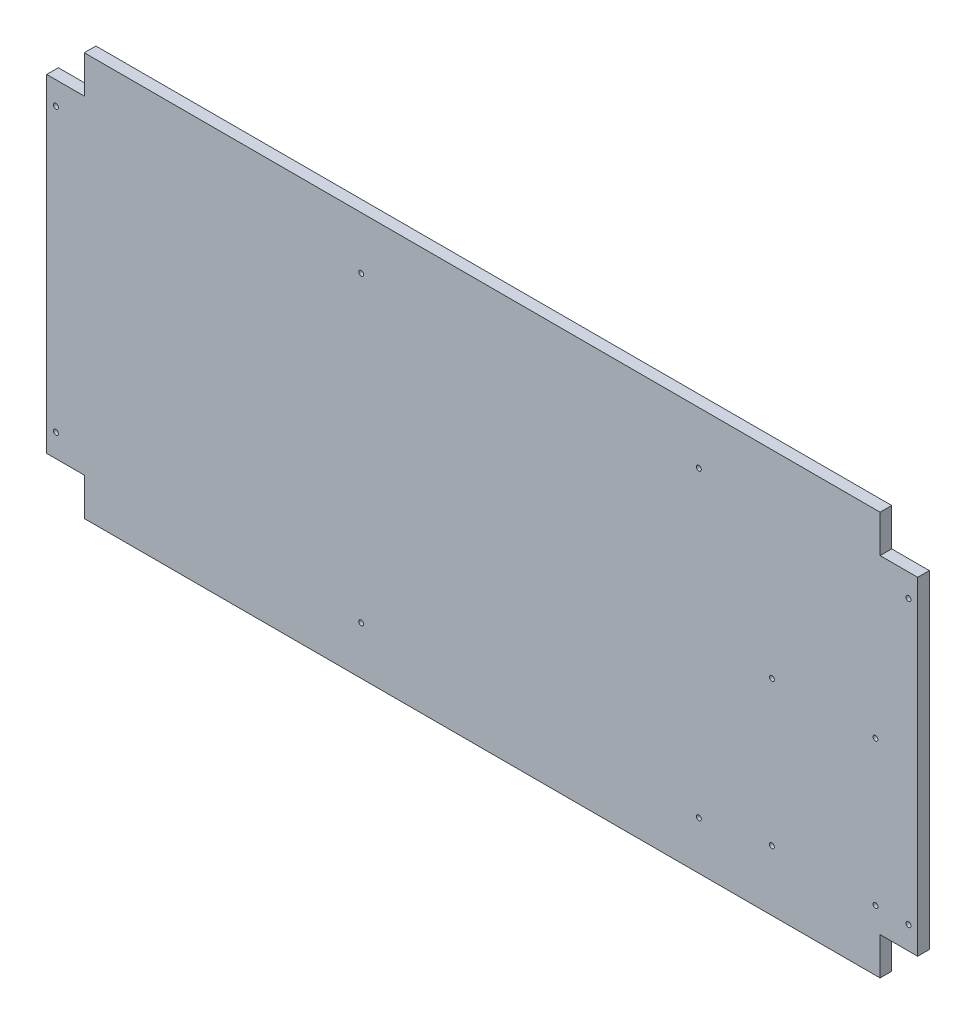
from build123d import *

# Parameters (mm, degrees)
SKETCH2_W           = 950
SKETCH2_H           = 440
BOSS_EXTRUDE1_DEPTH = 12.7
CUT_EXTRUDE1_REACH  = 525.628
SKETCH3_W           = 41
SKETCH3_H           = 41
CUT_EXTRUDE2_REACH  = 525.628
SKETCH4_R           = 2.75
CUT_EXTRUDE3_REACH  = 525.628
SKETCH6_R           = 2.665
CUT_EXTRUDE4_REACH  = 525.628
SKETCH7_R           = 2.665


with BuildPart() as part:
    # Sketch2 → Boss-Extrude1 (new body)
    with BuildSketch(Plane.XY):
        Rectangle(SKETCH2_W, SKETCH2_H)
    extrude(amount=BOSS_EXTRUDE1_DEPTH)

    # Sketch3 → Cut-Extrude1 (cut, up to next)
    with BuildSketch(Plane.XY.offset(12.7), mode=Mode.PRIVATE) as cut_extrude1_sk1:
        with Locations((-454.5, 199.5)):
            Rectangle(SKETCH3_W, SKETCH3_H)
    cut_extrude1_tool1 = extrude(cut_extrude1_sk1.sketch, amount=-CUT_EXTRUDE1_REACH, mode=Mode.PRIVATE) & part.part
    # Sketch3 → Cut-Extrude1 (cut, up to next)
    with BuildSketch(Plane.XY.offset(12.7), mode=Mode.PRIVATE) as cut_extrude1_sk2:
        with Locations((454.5, 199.5)):
            Rectangle(SKETCH3_W, SKETCH3_H)
    cut_extrude1_tool2 = extrude(cut_extrude1_sk2.sketch, amount=-CUT_EXTRUDE1_REACH, mode=Mode.PRIVATE) & part.part
    # Sketch3 → Cut-Extrude1 (cut, up to next)
    with BuildSketch(Plane.XY.offset(12.7), mode=Mode.PRIVATE) as cut_extrude1_sk3:
        with Locations((454.5, -199.5)):
            Rectangle(SKETCH3_W, SKETCH3_H)
    cut_extrude1_tool3 = extrude(cut_extrude1_sk3.sketch, amount=-CUT_EXTRUDE1_REACH, mode=Mode.PRIVATE) & part.part
    # Sketch3 → Cut-Extrude1 (cut, up to next)
    with BuildSketch(Plane.XY.offset(12.7), mode=Mode.PRIVATE) as cut_extrude1_sk4:
        with Locations((-454.5, -199.5)):
            Rectangle(SKETCH3_W, SKETCH3_H)
    cut_extrude1_tool4 = extrude(cut_extrude1_sk4.sketch, amount=-CUT_EXTRUDE1_REACH, mode=Mode.PRIVATE) & part.part
    add(cut_extrude1_tool1.solids().sort_by_distance((-454.5, 199.5, 12.7))[0], mode=Mode.SUBTRACT)
    add(cut_extrude1_tool2.solids().sort_by_distance((454.5, 199.5, 12.7))[0], mode=Mode.SUBTRACT)
    add(cut_extrude1_tool3.solids().sort_by_distance((454.5, -199.5, 12.7))[0], mode=Mode.SUBTRACT)
    add(cut_extrude1_tool4.solids().sort_by_distance((-454.5, -199.5, 12.7))[0], mode=Mode.SUBTRACT)

    # Sketch4 → Cut-Extrude2 (cut, up to next)
    with BuildSketch(Plane.XY.offset(12.7), mode=Mode.PRIVATE) as cut_extrude2_sk1:
        with Locations((-465, -154)):
            Circle(SKETCH4_R)
    cut_extrude2_tool1 = extrude(cut_extrude2_sk1.sketch, amount=-CUT_EXTRUDE2_REACH, mode=Mode.PRIVATE) & part.part
    # Sketch4 → Cut-Extrude2 (cut, up to next)
    with BuildSketch(Plane.XY.offset(12.7), mode=Mode.PRIVATE) as cut_extrude2_sk2:
        with Locations((-465, 154)):
            Circle(SKETCH4_R)
    cut_extrude2_tool2 = extrude(cut_extrude2_sk2.sketch, amount=-CUT_EXTRUDE2_REACH, mode=Mode.PRIVATE) & part.part
    # Sketch4 → Cut-Extrude2 (cut, up to next)
    with BuildSketch(Plane.XY.offset(12.7), mode=Mode.PRIVATE) as cut_extrude2_sk3:
        with Locations((465, -154)):
            Circle(SKETCH4_R)
    cut_extrude2_tool3 = extrude(cut_extrude2_sk3.sketch, amount=-CUT_EXTRUDE2_REACH, mode=Mode.PRIVATE) & part.part
    # Sketch4 → Cut-Extrude2 (cut, up to next)
    with BuildSketch(Plane.XY.offset(12.7), mode=Mode.PRIVATE) as cut_extrude2_sk4:
        with Locations((465, 154)):
            Circle(SKETCH4_R)
    cut_extrude2_tool4 = extrude(cut_extrude2_sk4.sketch, amount=-CUT_EXTRUDE2_REACH, mode=Mode.PRIVATE) & part.part
    add(cut_extrude2_tool1.solids().sort_by_distance((-465, -154, 12.7))[0], mode=Mode.SUBTRACT)
    add(cut_extrude2_tool2.solids().sort_by_distance((-465, 154, 12.7))[0], mode=Mode.SUBTRACT)
    add(cut_extrude2_tool3.solids().sort_by_distance((465, -154, 12.7))[0], mode=Mode.SUBTRACT)
    add(cut_extrude2_tool4.solids().sort_by_distance((465, 154, 12.7))[0], mode=Mode.SUBTRACT)

    # Sketch6 → Cut-Extrude3 (cut, up to next)
    with BuildSketch(Plane.XY.offset(12.7), mode=Mode.PRIVATE) as cut_extrude3_sk1:
        with Locations((-131.973398032, -167.519449166)):
            Circle(SKETCH6_R)
    cut_extrude3_tool1 = extrude(cut_extrude3_sk1.sketch, amount=-CUT_EXTRUDE3_REACH, mode=Mode.PRIVATE) & part.part
    # Sketch6 → Cut-Extrude3 (cut, up to next)
    with BuildSketch(Plane.XY.offset(12.7), mode=Mode.PRIVATE) as cut_extrude3_sk2:
        with Locations((236.326601968, -167.519449166)):
            Circle(SKETCH6_R)
    cut_extrude3_tool2 = extrude(cut_extrude3_sk2.sketch, amount=-CUT_EXTRUDE3_REACH, mode=Mode.PRIVATE) & part.part
    # Sketch6 → Cut-Extrude3 (cut, up to next)
    with BuildSketch(Plane.XY.offset(12.7), mode=Mode.PRIVATE) as cut_extrude3_sk3:
        with Locations((236.326601968, 162.680550834)):
            Circle(SKETCH6_R)
    cut_extrude3_tool3 = extrude(cut_extrude3_sk3.sketch, amount=-CUT_EXTRUDE3_REACH, mode=Mode.PRIVATE) & part.part
    # Sketch6 → Cut-Extrude3 (cut, up to next)
    with BuildSketch(Plane.XY.offset(12.7), mode=Mode.PRIVATE) as cut_extrude3_sk4:
        with Locations((-131.973398032, 162.680550834)):
            Circle(SKETCH6_R)
    cut_extrude3_tool4 = extrude(cut_extrude3_sk4.sketch, amount=-CUT_EXTRUDE3_REACH, mode=Mode.PRIVATE) & part.part
    add(cut_extrude3_tool1.solids().sort_by_distance((-131.973398, -167.519449, 12.7))[0], mode=Mode.SUBTRACT)
    add(cut_extrude3_tool2.solids().sort_by_distance((236.326602, -167.519449, 12.7))[0], mode=Mode.SUBTRACT)
    add(cut_extrude3_tool3.solids().sort_by_distance((236.326602, 162.680551, 12.7))[0], mode=Mode.SUBTRACT)
    add(cut_extrude3_tool4.solids().sort_by_distance((-131.973398, 162.680551, 12.7))[0], mode=Mode.SUBTRACT)

    # Sketch7 → Cut-Extrude4 (cut, up to next)
    with BuildSketch(Plane.XY.offset(12.7), mode=Mode.PRIVATE) as cut_extrude4_sk1:
        with Locations((429, 4)):
            Circle(SKETCH7_R)
    cut_extrude4_tool1 = extrude(cut_extrude4_sk1.sketch, amount=-CUT_EXTRUDE4_REACH, mode=Mode.PRIVATE) & part.part
    # Sketch7 → Cut-Extrude4 (cut, up to next)
    with BuildSketch(Plane.XY.offset(12.7), mode=Mode.PRIVATE) as cut_extrude4_sk2:
        with Locations((429, -154)):
            Circle(SKETCH7_R)
    cut_extrude4_tool2 = extrude(cut_extrude4_sk2.sketch, amount=-CUT_EXTRUDE4_REACH, mode=Mode.PRIVATE) & part.part
    # Sketch7 → Cut-Extrude4 (cut, up to next)
    with BuildSketch(Plane.XY.offset(12.7), mode=Mode.PRIVATE) as cut_extrude4_sk3:
        with Locations((316, 4)):
            Circle(SKETCH7_R)
    cut_extrude4_tool3 = extrude(cut_extrude4_sk3.sketch, amount=-CUT_EXTRUDE4_REACH, mode=Mode.PRIVATE) & part.part
    # Sketch7 → Cut-Extrude4 (cut, up to next)
    with BuildSketch(Plane.XY.offset(12.7), mode=Mode.PRIVATE) as cut_extrude4_sk4:
        with Locations((316, -154)):
            Circle(SKETCH7_R)
    cut_extrude4_tool4 = extrude(cut_extrude4_sk4.sketch, amount=-CUT_EXTRUDE4_REACH, mode=Mode.PRIVATE) & part.part
    add(cut_extrude4_tool1.solids().sort_by_distance((429, 4, 12.7))[0], mode=Mode.SUBTRACT)
    add(cut_extrude4_tool2.solids().sort_by_distance((429, -154, 12.7))[0], mode=Mode.SUBTRACT)
    add(cut_extrude4_tool3.solids().sort_by_distance((316, 4, 12.7))[0], mode=Mode.SUBTRACT)
    add(cut_extrude4_tool4.solids().sort_by_distance((316, -154, 12.7))[0], mode=Mode.SUBTRACT)


solid = part.part
